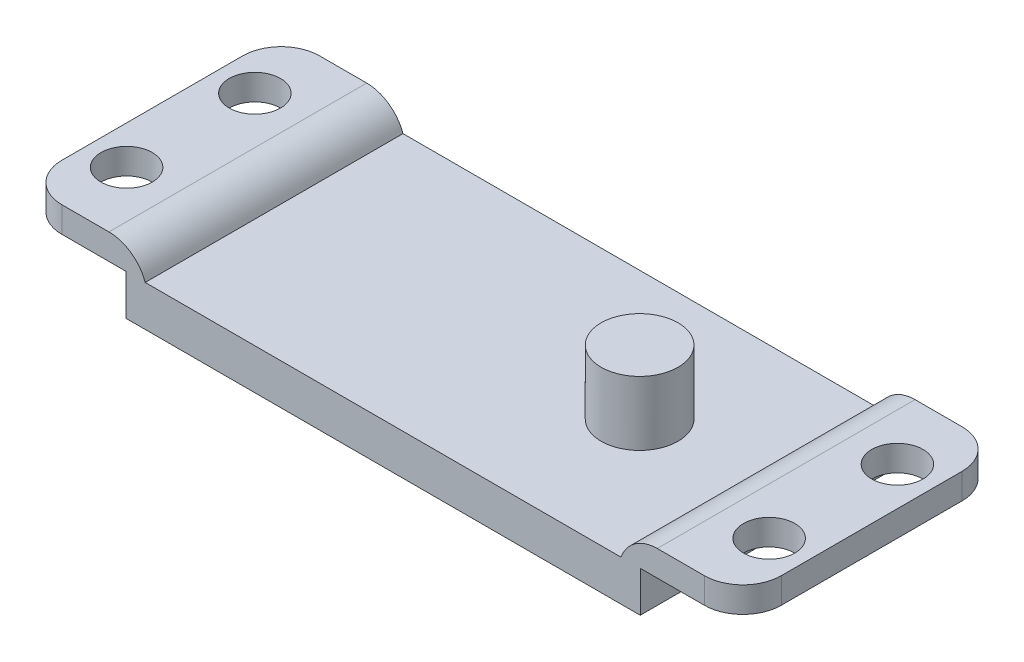
from build123d import *

# Parameters (mm, degrees)
SKETCH1_W            = 40.1
SKETCH1_H            = 20.1
BOSS_EXTRUDE1_DEPTH  = 3.175
SKETCH2_W            = 1.5
SKETCH2_H            = 20.1
BOSS_EXTRUDE2_DEPTH  = 2
SKETCH3_W            = 20.1
SKETCH3_H            = 2
BOSS_EXTRUDE3_DEPTH  = 8
SKETCH4_R            = 2
CUT_EXTRUDE1_DEPTH   = 30.964739695
FILLET1_R            = 3
FILLET2_R            = 3
FILLET1_OF_MIRROR2_R = 3
FILLET2_OF_MIRROR2_R = 3
SKETCH5_R            = 3
BOSS_EXTRUDE4_DEPTH  = 5


with BuildPart() as part:
    # Sketch1 → Boss-Extrude1 (new body)
    with BuildSketch(Plane(origin=(0, 0, 0), x_dir=(1, 0, 0), z_dir=(0, 1, 0))):
        Rectangle(SKETCH1_W, SKETCH1_H)
    extrude(amount=BOSS_EXTRUDE1_DEPTH)

    # Sketch2 → Boss-Extrude2 (add)
    with BuildSketch(Plane(origin=(0, 3.175, 0), x_dir=(1, 0, 0), z_dir=(0, 1, 0))):
        with Locations((19.3, 0)):
            Rectangle(SKETCH2_W, SKETCH2_H)
    boss_extrude2 = extrude(amount=BOSS_EXTRUDE2_DEPTH)

    # Sketch3 → Boss-Extrude3 (add)
    with BuildSketch(Plane(origin=(20.05, 0, 0), x_dir=(0, 0, -1), z_dir=(1, 0, 0))):
        with Locations((0, 4.175)):
            Rectangle(SKETCH3_W, SKETCH3_H)
    boss_extrude3 = extrude(amount=BOSS_EXTRUDE3_DEPTH)

    # Sketch4 → Cut-Extrude1 (cut, symmetric)
    with BuildSketch(Plane.XZ.offset(-3.175)):
        with Locations(Location((25.05, 5, 0), (0, 0, 270))):
            Circle(SKETCH4_R)
        with Locations(Location((25.05, -5, 0), (0, 0, 270))):
            Circle(SKETCH4_R)
    cut_extrude1 = extrude(amount=CUT_EXTRUDE1_DEPTH, both=True, mode=Mode.SUBTRACT)

    # Fillet1
    # the kernel refuses this fillet: 3 mm, written as the material it takes off along each edge
    with BuildSketch(Plane(origin=(18.55, 5.175, -17.121067812), x_dir=(0, -1, 0), z_dir=(0, 0, 1))) as fillet1_piece_1:
        with BuildLine():
            CenterArc((3, 2.828427125), FILLET1_R, 180, 70.528779366)
            Line((0, 2.828427125), (-0.06, 2.828427125))
            Line((-0.06, 2.828427125), (-0.06, 0))
            Line((-0.06, 0), (0, -0.06))
            ThreePointArc((0, -0.06), (1, -0.06), (1.98, -0.056568542))
            Line((1.98, -0.056568542), (2, 0))
        make_face()
    extrude(amount=34.242135624, mode=Mode.SUBTRACT)

    # Fillet2
    fillet2_edges = [part.edges().sort_by_distance(p)[0] for p in [
        (28.05, 4.175, 10.05),
        (28.05, 4.175, -10.05),
    ]]
    fillet(fillet2_edges, radius=FILLET2_R)

    # Mirror2: Boss-Extrude2, Boss-Extrude3, Cut-Extrude1 across plane
    add(boss_extrude2.mirror(Plane(origin=(0, 0, 0), x_dir=(0, 0, 1), z_dir=(1, 0, 0))))
    add(boss_extrude3.mirror(Plane(origin=(0, 0, 0), x_dir=(0, 0, 1), z_dir=(1, 0, 0))))
    add(cut_extrude1.mirror(Plane(origin=(0, 0, 0), x_dir=(0, 0, 1), z_dir=(1, 0, 0))), mode=Mode.SUBTRACT)

    # Fillet1 of Mirror2
    # the kernel refuses this fillet: 3 mm, written as the material it takes off along each edge
    with BuildSketch(Plane(origin=(-18.55, 5.175, -17.121067812), x_dir=(-1, 0, 0), z_dir=(0, 0, 1))) as fillet1_of_mirror2_piece_1:
        with BuildLine():
            CenterArc((2.828427125, 3), FILLET1_OF_MIRROR2_R, 199.471220634, 70.528779366)
            Line((0, 2), (-0.056568542, 1.98))
            ThreePointArc((-0.056568542, 1.98), (-0.06, 1), (-0.06, 0))
            Line((-0.06, 0), (0, -0.06))
            Line((0, -0.06), (2.828427125, -0.06))
            Line((2.828427125, -0.06), (2.828427125, 0))
        make_face()
    extrude(amount=34.242135624, mode=Mode.SUBTRACT)

    # Fillet2 of Mirror2
    fillet2_of_mirror2_edges = [part.edges().sort_by_distance(p)[0] for p in [
        (-28.05, 4.175, 10.05),
        (-28.05, 4.175, -10.05),
    ]]
    fillet(fillet2_of_mirror2_edges, radius=FILLET2_OF_MIRROR2_R)

    # Sketch5 → Boss-Extrude4 (add)
    with BuildSketch(Plane(origin=(0, 3.175, 0), x_dir=(1, 0, 0), z_dir=(0, 1, 0))):
        with Locations(Location((9.95, 0, 0), (0, 0, 90))):
            Circle(SKETCH5_R)
    extrude(amount=BOSS_EXTRUDE4_DEPTH)


solid = part.part
